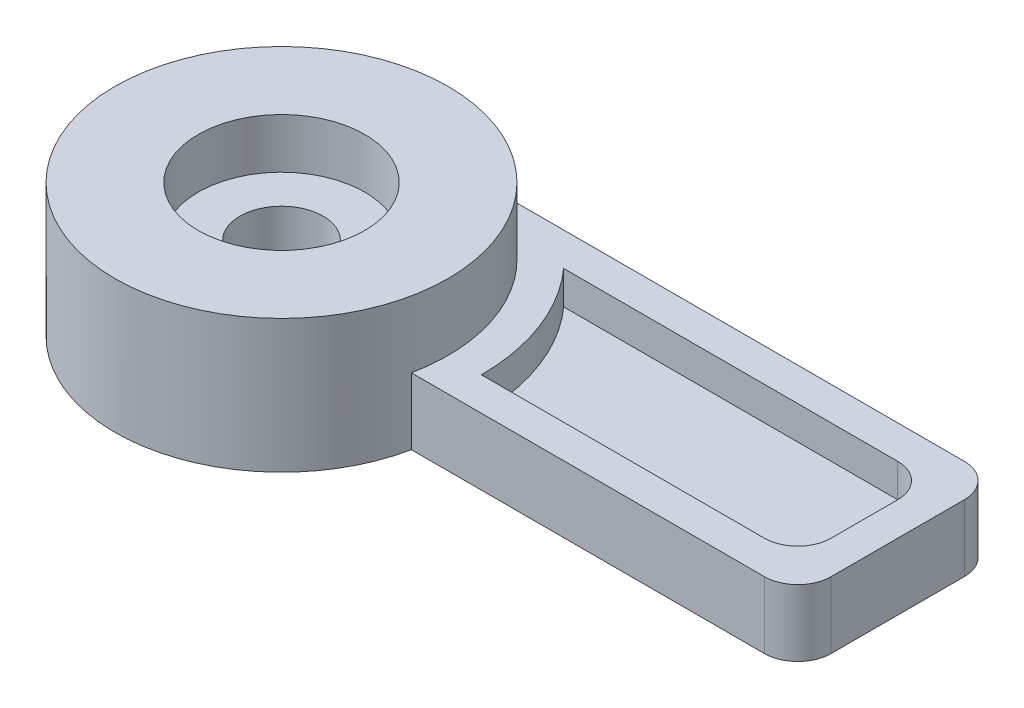
from build123d import *

# Parameters (mm, degrees)
EXTRUDE_1_DEPTH                = 20
EXTRUDE_2_DEPTH                = 40
EXTRUDE_3_DEPTH                = 10
FILLET_1_R                     = 10
HOLE_WIZARD_M1_6_1_D           = 25
HOLE_WIZARD_M1_6_1_CBORE_D     = 50
HOLE_WIZARD_M1_6_1_CBORE_DEPTH = 15


with BuildPart() as part:
    # 스케치2 → 보스-돌출1 (new body)
    with BuildSketch(Plane(origin=(0, 0, 0), x_dir=(1, 0, 0), z_dir=(0, 1, 0))):
        with BuildLine():
            Line((165, 50), (0, 50))
            ThreePointArc((0, 50), (35.355339059, 35.355339059), (50, 0))
            ThreePointArc((50, 0), (49.74680765, -5.0254481), (48.989794856, -10))
            Line((48.989794856, -10), (165, -10))
            Line((165, -10), (165, 50))
        make_face()
        with BuildLine():
            ThreePointArc((60, 0), (56.050341538, 21.409325386), (44.72135955, 40))
            Line((44.72135955, 40), (155, 40))
            Line((155, 40), (155, 0))
            Line((155, 0), (60, 0))
        make_face(mode=Mode.SUBTRACT)
    extrude(amount=EXTRUDE_1_DEPTH)

    # 스케치2<4> → 보스-돌출2 (add)
    with BuildSketch(Plane(origin=(0, 0, 0), x_dir=(1, 0, 0), z_dir=(0, 1, 0))):
        with BuildLine():
            ThreePointArc((50, 0), (35.355339059, 35.355339059), (0, 50))
            ThreePointArc((0, 50), (-38.729833462, -31.622776602), (48.989794856, -10))
            ThreePointArc((48.989794856, -10), (49.74680765, -5.0254481), (50, 0))
        make_face()
    extrude(amount=EXTRUDE_2_DEPTH)

    # 스케치2<5> → 보스-돌출3 (add)
    with BuildSketch(Plane(origin=(0, 0, 0), x_dir=(1, 0, 0), z_dir=(0, 1, 0))):
        with BuildLine():
            Line((44.72135955, 40), (155, 40))
            Line((155, 40), (155, 0))
            Line((155, 0), (60, 0))
            ThreePointArc((60, 0), (56.050341538, 21.409325386), (44.72135955, 40))
        make_face()
    extrude(amount=EXTRUDE_3_DEPTH)

    # 필렛1
    fillet_1_edges = [part.edges().sort_by_distance(p)[0] for p in [
        (165, 10, -50),
        (155, 15, -40),
        (155, 15, 0),
        (165, 10, 10),
    ]]
    fillet(fillet_1_edges, radius=FILLET_1_R)

    # M1.6 남비 머리 나사용 카운터보어1 (through all)
    with Locations(Plane(origin=(0, 40, 0), x_dir=(1, 0, 0), z_dir=(0, 1, 0))):
        with Locations((0, 0)):
            CounterBoreHole(HOLE_WIZARD_M1_6_1_D / 2, HOLE_WIZARD_M1_6_1_CBORE_D / 2, HOLE_WIZARD_M1_6_1_CBORE_DEPTH)


solid = part.part
